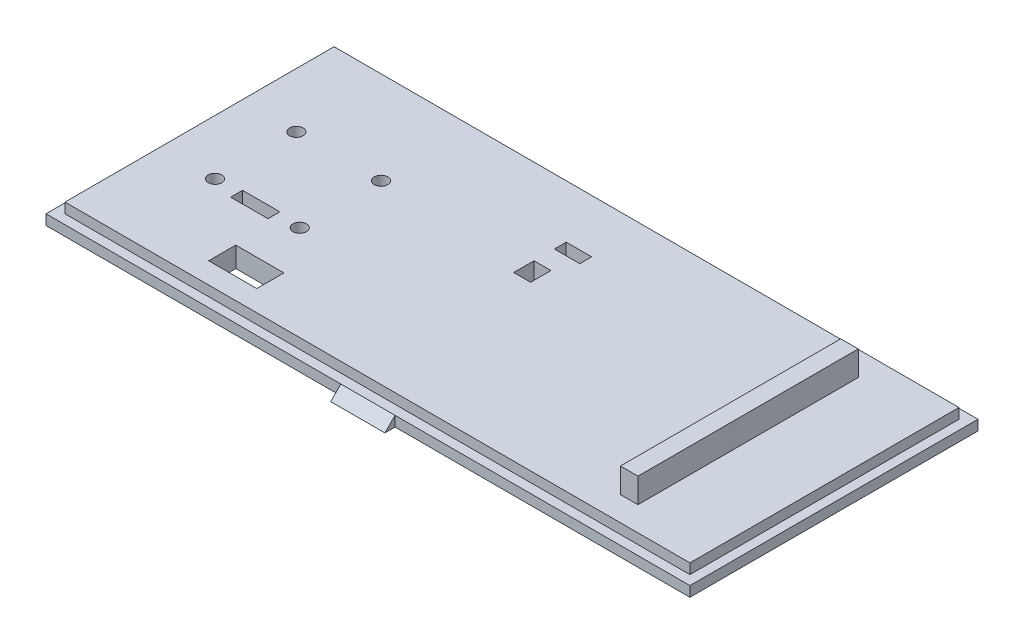
from build123d import *

# Parameters (mm, degrees)
SKETCH2_W               = 190
SKETCH2_H               = 85
BOSS_EXTRUDE1_DEPTH     = 3
SKETCH6_W               = 184.4
SKETCH6_H               = 79.4
BOSS_EXTRUDE4_DEPTH     = 3
SKETCH8_W               = 16
SKETCH8_H               = 3
BOSS_EXTRUDE5_DEPTH     = 3
CHAMFER2_SIZE           = 3
CUT_EXTRUDE1_DEPTH      = 210.475535564
CUT_EXTRUDE1_DEPTH_BACK = 210.475535564
SKETCH10_W              = 7.5
SKETCH10_H              = 3.5
SKETCH11_W              = 5
SKETCH11_H              = 6
CUT_EXTRUDE2_DEPTH      = 210.475535564
SKETCH12_R              = 2
SKETCH12_W              = 11
SKETCH12_H              = 3.5
CUT_EXTRUDE3_DEPTH      = 210.475535564
SKETCH13_W              = 14.2
SKETCH13_H              = 8
CUT_EXTRUDE4_DEPTH      = 210.475535564
SKETCH14_W              = 5.173747918
SKETCH14_H              = 65
BOSS_EXTRUDE6_DEPTH     = 7.3


with BuildPart() as part:
    # Sketch2 → Boss-Extrude1 (new body)
    with BuildSketch(Plane(origin=(0, 0, 0), x_dir=(1, 0, 0), z_dir=(0, 1, 0))):
        with Locations((-95, 42.5)):
            Rectangle(SKETCH2_W, SKETCH2_H)
    extrude(amount=BOSS_EXTRUDE1_DEPTH)

    # Sketch6 → Boss-Extrude4 (add)
    with BuildSketch(Plane(origin=(0, 3, 0), x_dir=(1, 0, 0), z_dir=(0, 1, 0))):
        with Locations((-95, 42.5)):
            Rectangle(SKETCH6_W, SKETCH6_H)
    extrude(amount=BOSS_EXTRUDE4_DEPTH)

    # Sketch8 → Boss-Extrude5 (add)
    with BuildSketch(Plane(origin=(0, 3, 0), x_dir=(1, 0, 0), z_dir=(0, 1, 0))):
        with Locations((-95, -1.5)):
            Rectangle(SKETCH8_W, SKETCH8_H)
        with Locations((-95, 86.5)):
            Rectangle(SKETCH8_W, SKETCH8_H)
    extrude(amount=-BOSS_EXTRUDE5_DEPTH)

    # Chamfer2
    chamfer2_edges = [part.edges().sort_by_distance(p)[0] for p in [
        (-95, 3, 3),
        (-95, 3, -88),
    ]]
    chamfer(chamfer2_edges, length=CHAMFER2_SIZE - 0.0001)  # a hair under: the kernel refuses the full size

    # Sketch10 → Cut-Extrude1 (cut, two sides: drawn at the far end of the back side and taken through both)
    with BuildSketch(Plane.XZ.offset(-CUT_EXTRUDE1_DEPTH_BACK)):
        with Locations((-99.25, -64.75)):
            Rectangle(SKETCH10_W, SKETCH10_H)
    extrude(amount=CUT_EXTRUDE1_DEPTH + CUT_EXTRUDE1_DEPTH_BACK, mode=Mode.SUBTRACT)

    # Sketch11 → Cut-Extrude2 (cut, through all)
    with BuildSketch(Plane.XZ):
        with Locations((-100.5, -54)):
            Rectangle(SKETCH11_W, SKETCH11_H)
    extrude(amount=-CUT_EXTRUDE2_DEPTH, mode=Mode.SUBTRACT)

    # Sketch12 → Cut-Extrude3 (cut, through all)
    with BuildSketch(Plane.XZ):
        with Locations(Location((-171, -54.875455527, 0), (0, 0, 270))):
            Circle(SKETCH12_R)
        with Locations(Location((-171, -30.875455527, 0), (0, 0, 270))):
            Circle(SKETCH12_R)
        with Locations(Location((-146, -54.875455527, 0), (0, 0, 90))):
            Circle(SKETCH12_R)
        with Locations(Location((-146, -30.875455527, 0), (0, 0, 90))):
            Circle(SKETCH12_R)
        with Locations((-158.5, -30.25)):
            Rectangle(SKETCH12_W, SKETCH12_H)
    extrude(amount=-CUT_EXTRUDE3_DEPTH, mode=Mode.SUBTRACT)

    # Sketch13 → Cut-Extrude4 (cut, through all)
    with BuildSketch(Plane.XZ):
        with Locations((-143.9, -13)):
            Rectangle(SKETCH13_W, SKETCH13_H)
    extrude(amount=-CUT_EXTRUDE4_DEPTH, mode=Mode.SUBTRACT)

    # Sketch14 → Boss-Extrude6 (add)
    with BuildSketch(Plane(origin=(0, 6, 0), x_dir=(1, 0, 0), z_dir=(0, 1, 0))):
        with Locations((-27.918538548, 42.5)):
            Rectangle(SKETCH14_W, SKETCH14_H)
    extrude(amount=BOSS_EXTRUDE6_DEPTH)


solid = part.part
